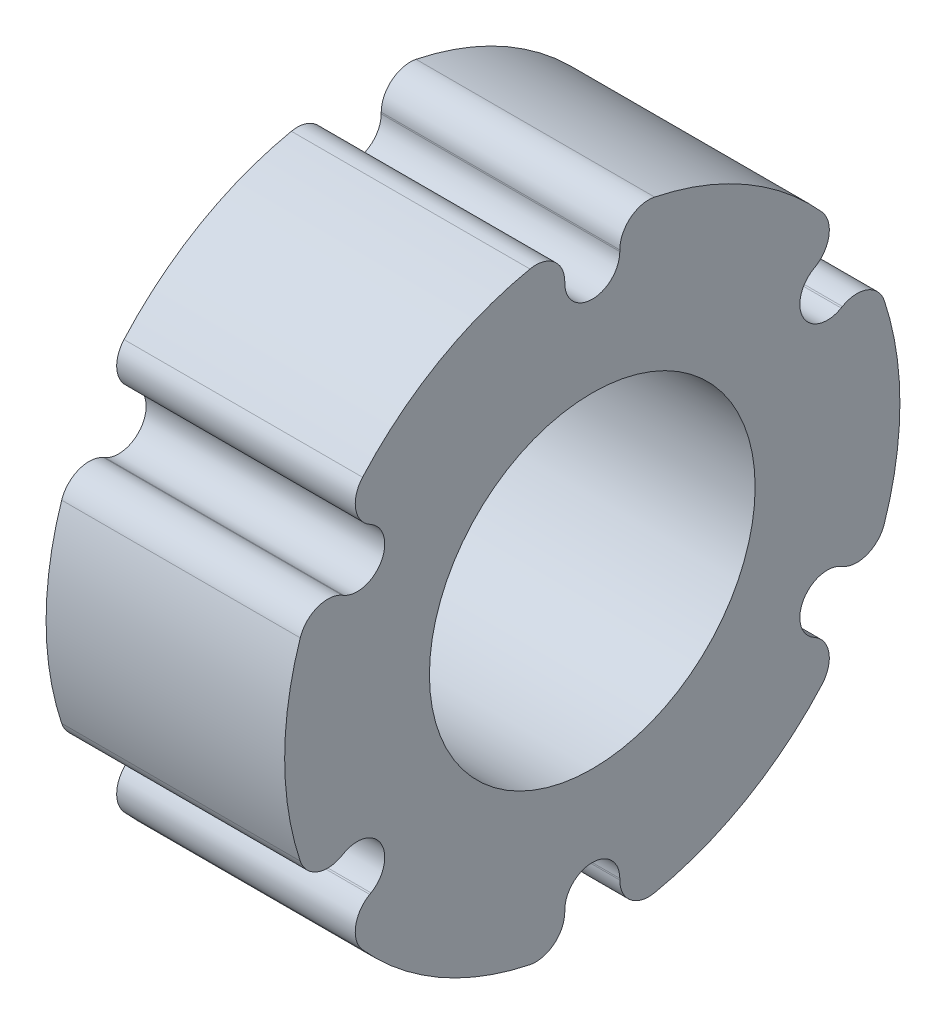
from build123d import *

# Parameters (mm, degrees)
SKETCH1_R           = 14.2875
BOSS_EXTRUDE1_DEPTH = 20.9296


with BuildPart() as part:
    # Sketch1 → Boss-Extrude1 (new body)
    with BuildSketch(Plane(origin=(0, 0, 0), x_dir=(0, 0, -1), z_dir=(1, 0, 0))):
        with BuildLine():
            Line((-2.413, 23.8125), (-2.413, 23.940510589))
            ThreePointArc((-2.413, 23.940510589), (-3.349172921, 25.91011428), (-5.467597403, 26.427836364))
            ThreePointArc((-5.467597403, 26.427836364), (-13.49375, 23.371860585), (-20.153378957, 17.94899643))
            ThreePointArc((-20.153378957, 17.94899643), (-20.764230721, 15.855525972), (-19.526590349, 14.059974594))
            Line((-19.526590349, 14.059974594), (-19.415729928, 13.995969299))
            ThreePointArc((-19.415729928, 13.995969299), (-18.532510628, 10.69975), (-21.828729928, 9.816530701))
            Line((-21.828729928, 9.816530701), (-21.939590349, 9.880535995))
            ThreePointArc((-21.939590349, 9.880535995), (-24.113403642, 10.054588309), (-25.62097636, 8.478839934))
            ThreePointArc((-25.62097636, 8.478839934), (-26.9875, 0), (-25.62097636, -8.478839934))
            ThreePointArc((-25.62097636, -8.478839934), (-24.113403642, -10.054588309), (-21.939590349, -9.880535995))
            Line((-21.939590349, -9.880535995), (-21.828729928, -9.816530701))
            ThreePointArc((-21.828729928, -9.816530701), (-18.532510628, -10.69975), (-19.415729928, -13.995969299))
            Line((-19.415729928, -13.995969299), (-19.526590349, -14.059974594))
            ThreePointArc((-19.526590349, -14.059974594), (-20.764230721, -15.855525972), (-20.153378957, -17.94899643))
            ThreePointArc((-20.153378957, -17.94899643), (-13.49375, -23.371860585), (-5.467597403, -26.427836364))
            ThreePointArc((-5.467597403, -26.427836364), (-3.349172921, -25.91011428), (-2.413, -23.940510589))
            Line((-2.413, -23.940510589), (-2.413, -23.8125))
            ThreePointArc((-2.413, -23.8125), (0, -21.3995), (2.413, -23.8125))
            Line((2.413, -23.8125), (2.413, -23.940510589))
            ThreePointArc((2.413, -23.940510589), (3.349172921, -25.91011428), (5.467597403, -26.427836364))
            ThreePointArc((5.467597403, -26.427836364), (13.49375, -23.371860585), (20.153378957, -17.94899643))
            ThreePointArc((20.153378957, -17.94899643), (20.764230721, -15.855525972), (19.526590349, -14.059974594))
            Line((19.526590349, -14.059974594), (19.415729928, -13.995969299))
            ThreePointArc((19.415729928, -13.995969299), (18.532510628, -10.69975), (21.828729928, -9.816530701))
            Line((21.828729928, -9.816530701), (21.939590349, -9.880535995))
            ThreePointArc((21.939590349, -9.880535995), (24.113403642, -10.054588309), (25.62097636, -8.478839934))
            ThreePointArc((25.62097636, -8.478839934), (26.9875, 0), (25.62097636, 8.478839934))
            ThreePointArc((25.62097636, 8.478839934), (24.113403642, 10.054588309), (21.939590349, 9.880535995))
            Line((21.939590349, 9.880535995), (21.828729928, 9.816530701))
            ThreePointArc((21.828729928, 9.816530701), (18.532510628, 10.69975), (19.415729928, 13.995969299))
            Line((19.415729928, 13.995969299), (19.526590349, 14.059974594))
            ThreePointArc((19.526590349, 14.059974594), (20.764230721, 15.855525972), (20.153378957, 17.94899643))
            ThreePointArc((20.153378957, 17.94899643), (13.49375, 23.371860585), (5.467597403, 26.427836364))
            ThreePointArc((5.467597403, 26.427836364), (3.349172921, 25.91011428), (2.413, 23.940510589))
            Line((2.413, 23.940510589), (2.413, 23.8125))
            ThreePointArc((2.413, 23.8125), (0, 21.3995), (-2.413, 23.8125))
        make_face()
        Circle(SKETCH1_R, mode=Mode.SUBTRACT)
    extrude(amount=BOSS_EXTRUDE1_DEPTH)


solid = part.part
